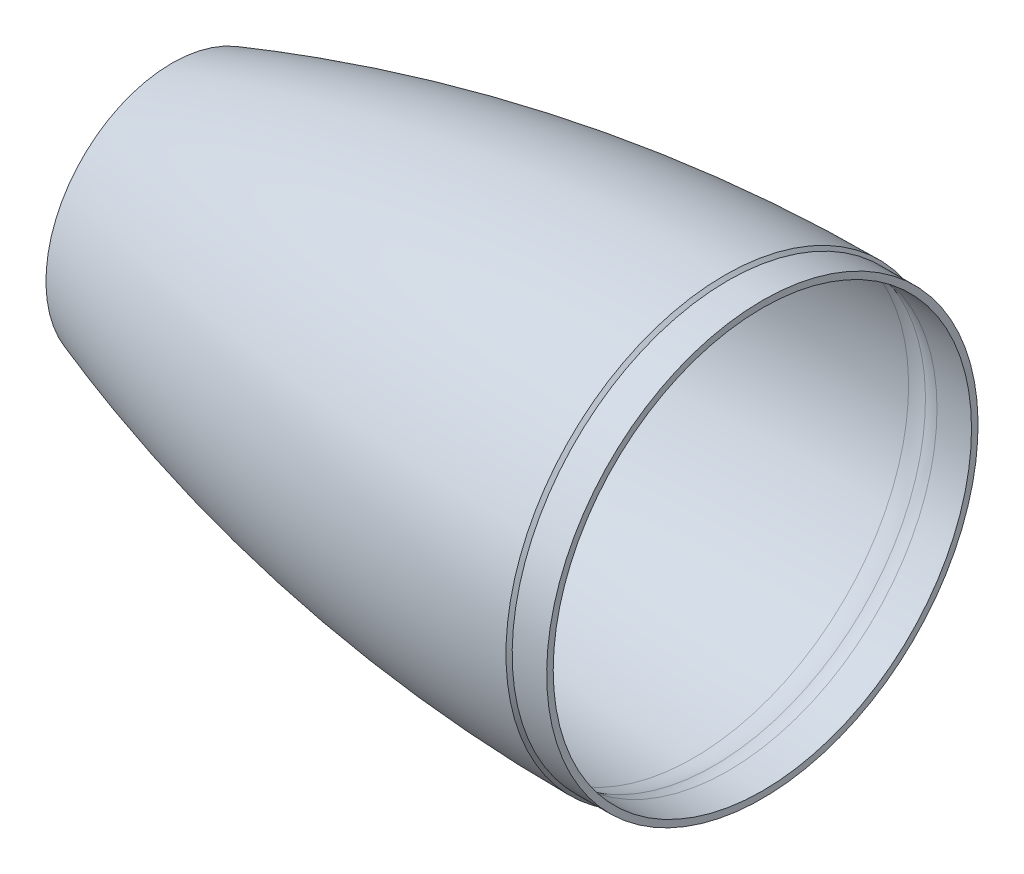
from build123d import *

# Parameters (mm, degrees)
FILLET1_R = 3.175


with BuildPart() as part:
    # Sketch1 → Revolve1 (revolve)
    with BuildSketch(Plane.XY):
        with BuildLine():
            Line((1.143, 79.375), (13.843, 79.375))
            Line((13.843, 79.375), (13.843, 76.975))
            Line((13.843, 76.975), (1.143, 76.975))
            ThreePointArc((1.143, 76.975), (-1.493261461, 77.212559303), (-4.044584679, 77.917583239))
            ThreePointArc((-4.044584679, 77.917583239), (-7.739504947, 78.920164754), (-11.557, 79.210573098))
            ThreePointArc((-11.557, 79.210573098), (-104.887907305, 70.40631157), (-195.834, 47.669084324))
            Line((-195.834, 47.669084324), (-199.644, 44.1325))
            Line((-199.644, 44.1325), (-203.454, 44.1325))
            Line((-203.454, 44.1325), (-203.454, 46.355))
            ThreePointArc((-203.454, 46.355), (-103.15115206, 71.917881411), (0, 80.518))
            Line((0, 80.518), (1.143, 79.375))
        make_face()
    revolve(axis=Axis((0, 0, 0), (-1, 0, 0)))

    # Fillet1
    fillet1_edges = [part.edges().sort_by_distance(p)[0] for p in [
        (-199.644, -44.1325, 0),
        (-195.834, -47.669084324, 0),
    ]]
    fillet(fillet1_edges, radius=FILLET1_R)


solid = part.part
